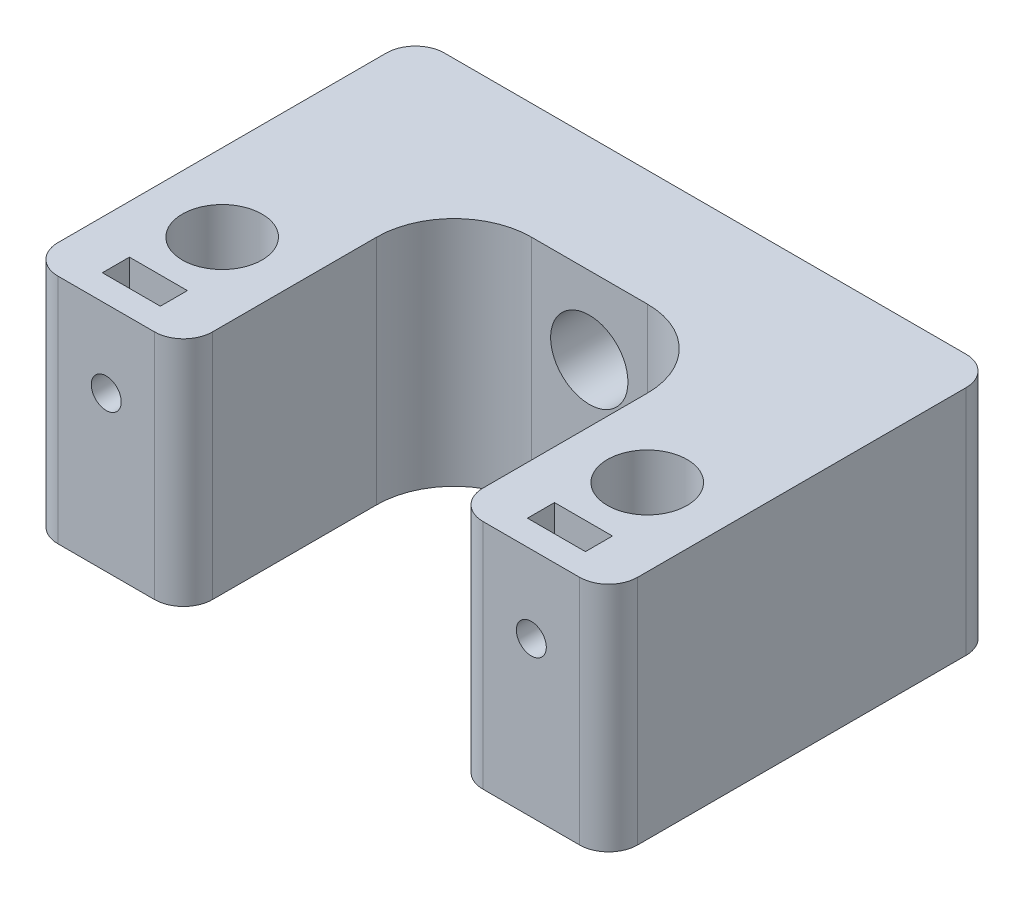
from build123d import *

# Parameters (mm, degrees)
SKETCH1_R           = 4.125
BOSS_EXTRUDE1_DEPTH = 24
SKETCH2_W           = 6
SKETCH2_H           = 2.8
CUT_EXTRUDE1_DEPTH  = 48.539457296
SKETCH3_R           = 1.55
CUT_EXTRUDE2_DEPTH  = 10
FILLET1_R           = 8
FILLET2_R           = 3
SKETCH4_R           = 4
CUT_EXTRUDE3_DEPTH  = 48.539457347


with BuildPart() as part:
    # Sketch1 → Boss-Extrude1 (new body)
    with BuildSketch(Plane(origin=(0, 0, 0), x_dir=(1, 0, 0), z_dir=(0, 1, 0))):
        Polygon((30, 28), (-30, 28), (-30, -12), (-14, -12), (-14, 16), (14, 16), (14, -12), (30, -12), align=None)
        with Locations((-22, 0)):
            Circle(SKETCH1_R, mode=Mode.SUBTRACT)
        with Locations((22, 0)):
            Circle(SKETCH1_R, mode=Mode.SUBTRACT)
    extrude(amount=BOSS_EXTRUDE1_DEPTH)

    # Sketch2 → Cut-Extrude1 (cut, through all)
    with BuildSketch(Plane(origin=(0, 24, 0), x_dir=(1, 0, 0), z_dir=(0, 1, 0))):
        with Locations((-22, -8)):
            Rectangle(SKETCH2_W, SKETCH2_H)
    cut_extrude1 = extrude(amount=-CUT_EXTRUDE1_DEPTH, mode=Mode.SUBTRACT)

    # Sketch3 → Cut-Extrude2 (cut)
    with BuildSketch(Plane.XY.offset(12)):
        with Locations((-22, 16)):
            Circle(SKETCH3_R)
    cut_extrude2 = extrude(amount=-CUT_EXTRUDE2_DEPTH, mode=Mode.SUBTRACT)

    # Mirror1: Cut-Extrude1, Cut-Extrude2 across plane
    add(cut_extrude1.mirror(Plane(origin=(0, 0, 0), x_dir=(0, 0, 1), z_dir=(1, 0, 0))), mode=Mode.SUBTRACT)
    add(cut_extrude2.mirror(Plane(origin=(0, 0, 0), x_dir=(0, 0, 1), z_dir=(1, 0, 0))), mode=Mode.SUBTRACT)

    # Fillet1
    fillet1_edges = [part.edges().sort_by_distance(p)[0] for p in [
        (14, 12, -16),
        (-14, 12, -16),
    ]]
    fillet(fillet1_edges, radius=FILLET1_R)

    # Fillet2
    fillet2_edges = [part.edges().sort_by_distance(p)[0] for p in [
        (-30, 12, -28),
        (30, 12, -28),
        (30, 12, 12),
        (14, 12, 12),
        (-30, 12, 12),
        (-14, 12, 12),
    ]]
    fillet(fillet2_edges, radius=FILLET2_R)

    # Sketch4 → Cut-Extrude3 (cut, through all)
    with BuildSketch(Plane.XY.offset(-16)):
        with Locations((0, 16)):
            Circle(SKETCH4_R)
    extrude(amount=-CUT_EXTRUDE3_DEPTH, mode=Mode.SUBTRACT)


solid = part.part
